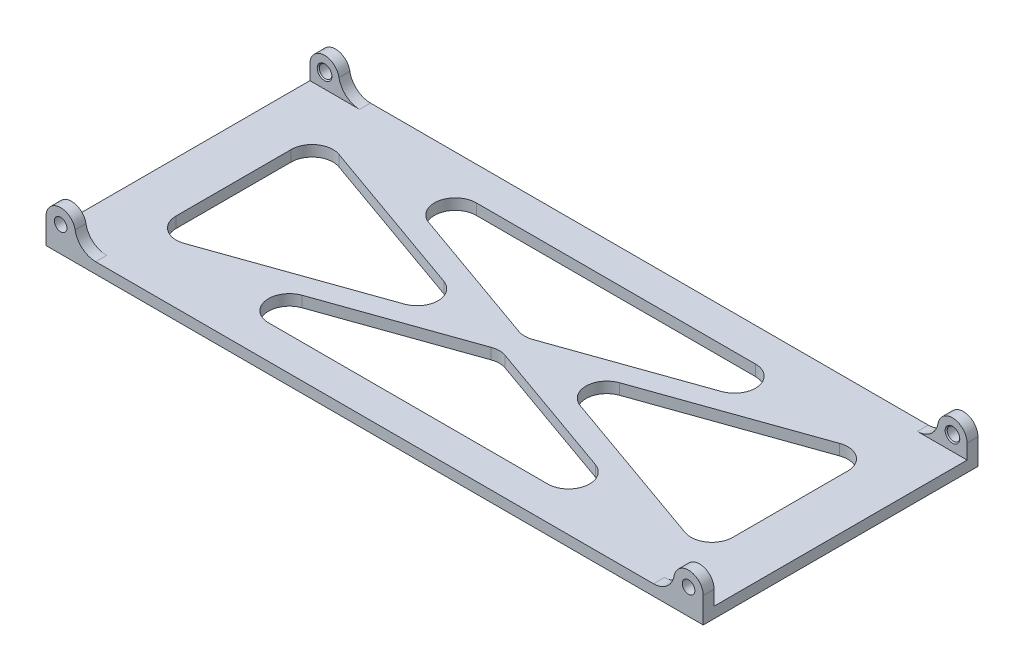
from build123d import *

# Parameters (mm, degrees)
SKETCH1_W           = 156.9
SKETCH1_H           = 65.6
BOSS_EXTRUDE1_DEPTH = 2.6
SKETCH2_W           = 7
SKETCH2_H           = 2.6
BOSS_EXTRUDE2_DEPTH = 7
SKETCH3_R           = 1.49999999
CUT_EXTRUDE1_DEPTH  = 103.712815656
FILLET1_R           = 5
CUT_EXTRUDE2_DEPTH  = 3.5
FILLET3_R           = 5
CHAMFER1_SIZE       = 0.25


with BuildPart() as part:
    # Sketch1 → Boss-Extrude1 (new body)
    with BuildSketch(Plane(origin=(0, 0, 0), x_dir=(1, 0, 0), z_dir=(0, 1, 0))):
        Rectangle(SKETCH1_W, SKETCH1_H)
    extrude(amount=BOSS_EXTRUDE1_DEPTH)

    # Sketch2 → Boss-Extrude2 (add)
    with BuildSketch(Plane(origin=(0, 2.6, 0), x_dir=(1, 0, 0), z_dir=(0, 1, 0))):
        with Locations((-74.95, 31.5)):
            Rectangle(SKETCH2_W, SKETCH2_H)
        with Locations((-74.95, -31.5)):
            Rectangle(SKETCH2_W, SKETCH2_H)
        with Locations((74.95, -31.5)):
            Rectangle(SKETCH2_W, SKETCH2_H)
        with Locations((74.95, 31.5)):
            Rectangle(SKETCH2_W, SKETCH2_H)
    extrude(amount=BOSS_EXTRUDE2_DEPTH)

    # Sketch3 → Cut-Extrude1 (cut, through all)
    with BuildSketch(Plane(origin=(0, 0, -32.8), x_dir=(-1, 0, 0), z_dir=(0, 0, -1))):
        with BuildLine():
            Line((-78.45, 9.6), (-78.45, 6.1))
            ThreePointArc((-78.45, 6.1), (-77.424873734, 8.574873734), (-74.95, 9.6))
            Line((-74.95, 9.6), (-78.45, 9.6))
        make_face()
        with BuildLine():
            Line((-71.45, 9.6), (-74.95, 9.6))
            ThreePointArc((-74.95, 9.6), (-72.475126266, 8.574873734), (-71.45, 6.1))
            Line((-71.45, 6.1), (-71.45, 9.6))
        make_face()
        with Locations((74.95, 6.1)):
            Circle(SKETCH3_R)
        with BuildLine():
            Line((74.95, 9.6), (71.45, 9.6))
            Line((71.45, 9.6), (71.45, 6.1))
            ThreePointArc((71.45, 6.1), (72.475126266, 8.574873734), (74.95, 9.6))
        make_face()
        with BuildLine():
            Line((78.45, 9.6), (74.95, 9.6))
            ThreePointArc((74.95, 9.6), (77.424873734, 8.574873734), (78.45, 6.1))
            Line((78.45, 6.1), (78.45, 9.6))
        make_face()
        with Locations((-74.95, 6.1)):
            Circle(SKETCH3_R)
    extrude(amount=-CUT_EXTRUDE1_DEPTH, mode=Mode.SUBTRACT)

    # Fillet1
    # the kernel refuses this fillet: 5 mm, written as the material it adds along each edge
    with BuildSketch(Plane(origin=(-71.45, 2.6, 32.8), x_dir=(1, 0, 0), z_dir=(0, 0, -1))) as fillet1_piece_1:
        with BuildLine():
            CenterArc((4.866600265, -5), FILLET1_R, 90, 79.835751378)
            Line((-0.054929303, -4.117647059), (-0.547082259, -4.029411765))
            ThreePointArc((-0.547082259, -4.029411765), (-0.5, -3.5), (-0.5, 0))
            Line((-0.5, 0), (0, 0.5))
            Line((0, 0.5), (4.866600265, 0.5))
            Line((4.866600265, 0.5), (4.866600265, 0))
        make_face()
    extrude(amount=2.6)
    with BuildSketch(Plane(origin=(71.45, 2.6, 32.8), x_dir=(0.01333878666755776, 0.9999110344276821, 0), z_dir=(0, 0, -1)), Plane(origin=(-71.45, 2.6, -32.8), x_dir=(-0.013338786667550865, 0.9999110344276821, 0), z_dir=(0, 0, 1))) as fillet1_piece_2:
        with BuildLine():
            CenterArc((4.934640629, -4.932861239), FILLET1_R, 99.399969777, 79.835751378)
            Line((-0.064914543, -4.866167305), (-0.56487006, -4.859497912))
            Line((-0.56487006, -4.859497912), (-0.499955517, 0.006669393))
            Line((-0.499955517, 0.006669393), (0.006669393, 0.499955517))
            ThreePointArc((0.006669393, 0.499955517), (3.506358014, 0.453269764), (4.036350699, 0.493286124))
            Line((4.036350699, 0.493286124), (4.11801342, 0))
        make_face()
    extrude(amount=2.6)
    with BuildSketch(Plane(origin=(71.45, 2.6, -32.8), x_dir=(0.01333878666755776, 0.9999110344276821, 0), z_dir=(0, 0, 1))) as fillet1_piece_3:
        with BuildLine():
            CenterArc((4.934640629, 4.932861239), FILLET1_R, 180.764278845, 79.835751378)
            Line((-0.064914543, 4.866167305), (-0.56487006, 4.859497912))
            Line((-0.56487006, 4.859497912), (-0.499955517, -0.006669393))
            Line((-0.499955517, -0.006669393), (0.006669393, -0.499955517))
            ThreePointArc((0.006669393, -0.499955517), (3.506358014, -0.453269764), (4.036350699, -0.493286124))
            Line((4.036350699, -0.493286124), (4.11801342, 0))
        make_face()
    extrude(amount=2.6)

    # Sketch4 → Cut-Extrude2 (cut)
    with BuildSketch(Plane(origin=(0, 2.6, 0), x_dir=(1, 0, 0), z_dir=(0, 1, 0))):
        Polygon((-62.45, -24.8), (0, -2.707525213), (62.45, -24.8), align=None)
        Polygon((-66.45, -20.8), (-66.45, 20.8), (-7.653508772, 0), align=None)
        Polygon((66.45, -20.8), (66.45, 20.8), (7.653508772, 0), align=None)
        Polygon((-62.45, 24.8), (62.45, 24.8), (0, 2.707525213), align=None)
    extrude(amount=-CUT_EXTRUDE2_DEPTH, mode=Mode.SUBTRACT)

    # Fillet3
    fillet3_edges = [part.edges().sort_by_distance(p)[0] for p in [
        (0, 1.3, -2.707525213),
        (-62.45, 1.3, -24.8),
        (62.45, 1.3, -24.8),
        (-7.653508772, 1.3, 0),
        (-66.45, 1.3, 20.8),
        (-66.45, 1.3, -20.8),
        (66.45, 1.3, 20.8),
        (7.653508772, 1.3, 0),
        (66.45, 1.3, -20.8),
        (62.45, 1.3, 24.8),
        (-62.45, 1.3, 24.8),
        (0, 1.3, 2.707525213),
    ]]
    fillet(fillet3_edges, radius=FILLET3_R)

    # Chamfer1
    chamfer1_edges = [part.edges().sort_by_distance(p)[0] for p in [
        (-73.45000001, 6.1, -30.2),
        (-73.45000001, 6.1, 30.2),
        (76.44999999, 6.1, 30.2),
        (76.44999999, 6.1, -30.2),
    ]]
    chamfer(chamfer1_edges, length=CHAMFER1_SIZE)


solid = part.part
